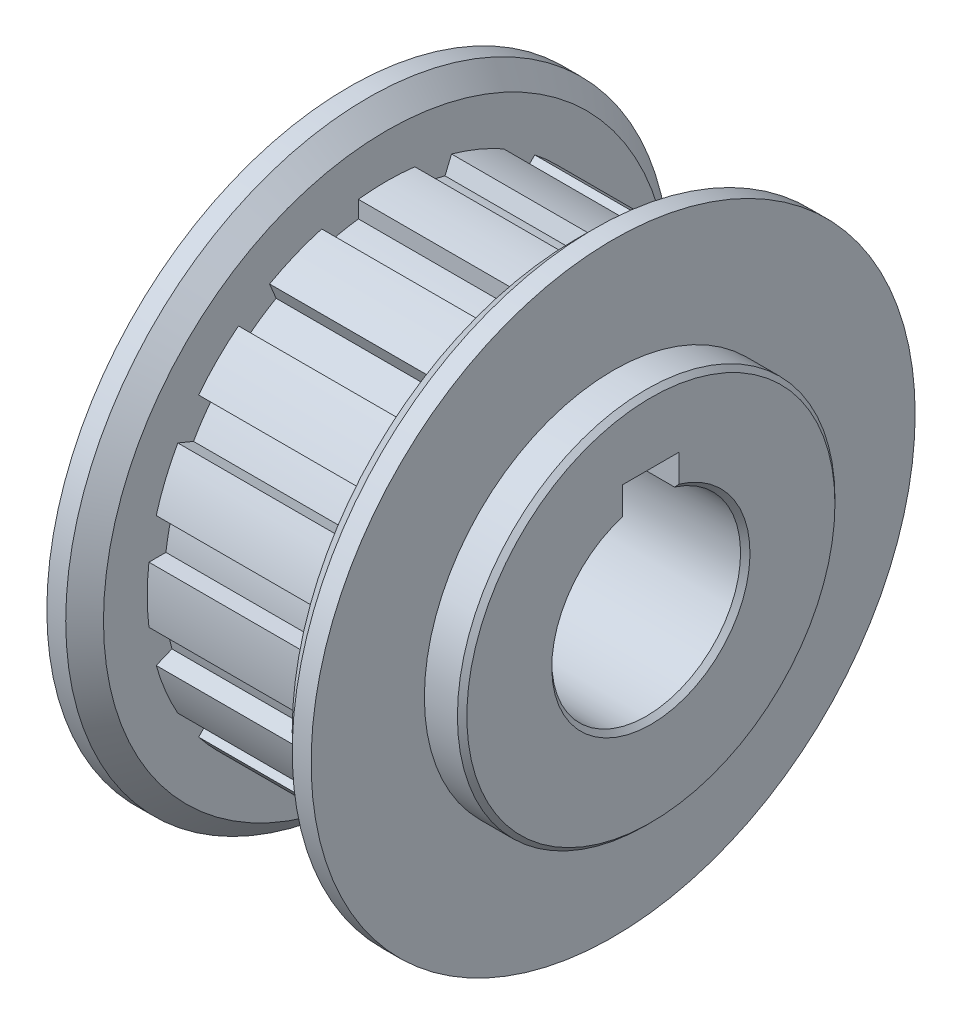
from build123d import *

# Parameters (mm, degrees)
BOSS_EXTRUDE1_START       = -13
BOSS_EXTRUDE1_DEPTH       = 14
BOSS_EXTRUDE1_START_2     = -25
BOSS_EXTRUDE1_2_OUTLINE_R = 9
BOSS_EXTRUDE1_2_DEPTH     = 12
BOSS_EXTRUDE1_START_3     = -1
BOSS_EXTRUDE1_3_OUTLINE_R = 16
BOSS_EXTRUDE1_3_DEPTH     = 2
BOSS_EXTRUDE1_4_OUTLINE_R = 14.25
BOSS_EXTRUDE1_4_DEPTH     = 0.9999999
SKETCH5_R                 = 16
BOSS_EXTRUDE3_DEPTH       = 2
SKETCH6_R                 = 10
BOSS_EXTRUDE4_DEPTH       = 12
CHAMFER1_SIZE             = 1
CUT_EXTRUDE1_START        = -10
SKETCH2_R                 = 10
SKETCH2_R_2               = 7.5
CUT_EXTRUDE1_DEPTH        = 10
CUT_EXTRUDE2_DEPTH        = 28.712812921
CUT_EXTRUDE2_DEPTH_BACK   = 28.712812921
SKETCH4_R                 = 5
CUT_EXTRUDE3_START        = -10
SKETCH7_R                 = 7.5
CUT_EXTRUDE3_DEPTH        = 10
CHAMFER2_SIZE             = 0.25
SKETCH8_W                 = 3
SKETCH8_H                 = 3
CUT_EXTRUDE4_DEPTH        = 28.712812921


with BuildPart() as part:
    # Boss-Extrude1: read off the stored shape, not the designer's step
    # Boss-Extrude1 outline → Boss-Extrude1 (new body)
    with BuildSketch(Plane.ZY.offset(BOSS_EXTRUDE1_START)):
        with BuildLine():
            ThreePointArc((-1.493827307, 11.692460658), (-2.299627171, 11.561006493), (-3.094394503, 11.374088047))
            Line((-3.094394503, 11.374088047), (-3.438518062, 12.20487581))
            ThreePointArc((-3.438518062, 12.20487581), (-4.852425922, 11.714792472), (-6.19875101, 11.061549888))
            Line((-6.19875101, 11.061549888), (-5.854627451, 10.230762125))
            ThreePointArc((-5.854627451, 10.230762125), (-6.548784122, 9.800948055), (-7.211522801, 9.324113638))
            Line((-7.211522801, 9.324113638), (-7.847380226, 9.959971063))
            ThreePointArc((-7.847380226, 9.959971063), (-8.966113985, 8.966113985), (-9.959971063, 7.847380226))
            Line((-9.959971063, 7.847380226), (-9.324113638, 7.211522801))
            ThreePointArc((-9.324113638, 7.211522801), (-9.800948055, 6.548784122), (-10.230762125, 5.854627451))
            Line((-10.230762125, 5.854627451), (-11.061549888, 6.19875101))
            ThreePointArc((-11.061549888, 6.19875101), (-11.714792472, 4.852425922), (-12.20487581, 3.438518062))
            Line((-12.20487581, 3.438518062), (-11.374088047, 3.094394503))
            ThreePointArc((-11.374088047, 3.094394503), (-11.561006493, 2.299627171), (-11.692460658, 1.493827307))
            Line((-11.692460658, 1.493827307), (-12.591698852, 1.493827307))
            ThreePointArc((-12.591698852, 1.493827307), (-12.68, 0), (-12.591698852, -1.493827307))
            Line((-12.591698852, -1.493827307), (-11.692460658, -1.493827307))
            ThreePointArc((-11.692460658, -1.493827307), (-11.561006493, -2.299627171), (-11.374088047, -3.094394503))
            Line((-11.374088047, -3.094394503), (-12.20487581, -3.438518062))
            ThreePointArc((-12.20487581, -3.438518062), (-11.714792472, -4.852425922), (-11.061549888, -6.19875101))
            Line((-11.061549888, -6.19875101), (-10.230762125, -5.854627451))
            ThreePointArc((-10.230762125, -5.854627451), (-9.800948055, -6.548784122), (-9.324113638, -7.211522801))
            Line((-9.324113638, -7.211522801), (-9.959971063, -7.847380226))
            ThreePointArc((-9.959971063, -7.847380226), (-8.966113985, -8.966113985), (-7.847380226, -9.959971063))
            Line((-7.847380226, -9.959971063), (-7.211522801, -9.324113638))
            ThreePointArc((-7.211522801, -9.324113638), (-6.548784122, -9.800948055), (-5.854627451, -10.230762125))
            Line((-5.854627451, -10.230762125), (-6.19875101, -11.061549888))
            ThreePointArc((-6.19875101, -11.061549888), (-4.852425922, -11.714792472), (-3.438518062, -12.20487581))
            Line((-3.438518062, -12.20487581), (-3.094394503, -11.374088047))
            ThreePointArc((-3.094394503, -11.374088047), (-2.299627171, -11.561006493), (-1.493827307, -11.692460658))
            Line((-1.493827307, -11.692460658), (-1.493827307, -12.591698852))
            ThreePointArc((-1.493827307, -12.591698852), (0, -12.68), (1.493827307, -12.591698852))
            Line((1.493827307, -12.591698852), (1.493827307, -11.692460658))
            ThreePointArc((1.493827307, -11.692460658), (2.299627171, -11.561006493), (3.094394503, -11.374088047))
            Line((3.094394503, -11.374088047), (3.438518062, -12.20487581))
            ThreePointArc((3.438518062, -12.20487581), (4.852425922, -11.714792472), (6.19875101, -11.061549888))
            Line((6.19875101, -11.061549888), (5.854627451, -10.230762125))
            ThreePointArc((5.854627451, -10.230762125), (6.548784122, -9.800948055), (7.211522801, -9.324113638))
            Line((7.211522801, -9.324113638), (7.847380226, -9.959971063))
            ThreePointArc((7.847380226, -9.959971063), (8.966113985, -8.966113985), (9.959971063, -7.847380226))
            Line((9.959971063, -7.847380226), (9.324113638, -7.211522801))
            ThreePointArc((9.324113638, -7.211522801), (9.800948055, -6.548784122), (10.230762125, -5.854627451))
            Line((10.230762125, -5.854627451), (11.061549888, -6.19875101))
            ThreePointArc((11.061549888, -6.19875101), (11.714792472, -4.852425922), (12.20487581, -3.438518062))
            Line((12.20487581, -3.438518062), (11.374088047, -3.094394503))
            ThreePointArc((11.374088047, -3.094394503), (11.561006493, -2.299627171), (11.692460658, -1.493827307))
            Line((11.692460658, -1.493827307), (12.591698852, -1.493827307))
            ThreePointArc((12.591698852, -1.493827307), (12.68, 0), (12.591698852, 1.493827307))
            Line((12.591698852, 1.493827307), (11.692460658, 1.493827307))
            ThreePointArc((11.692460658, 1.493827307), (11.561006493, 2.299627171), (11.374088047, 3.094394503))
            Line((11.374088047, 3.094394503), (12.20487581, 3.438518062))
            ThreePointArc((12.20487581, 3.438518062), (11.714792472, 4.852425922), (11.061549888, 6.19875101))
            Line((11.061549888, 6.19875101), (10.230762125, 5.854627451))
            ThreePointArc((10.230762125, 5.854627451), (9.800948055, 6.548784122), (9.324113638, 7.211522801))
            Line((9.324113638, 7.211522801), (9.959971063, 7.847380226))
            ThreePointArc((9.959971063, 7.847380226), (8.966113985, 8.966113985), (7.847380226, 9.959971063))
            Line((7.847380226, 9.959971063), (7.211522801, 9.324113638))
            ThreePointArc((7.211522801, 9.324113638), (6.548784122, 9.800948055), (5.854627451, 10.230762125))
            Line((5.854627451, 10.230762125), (6.19875101, 11.061549888))
            ThreePointArc((6.19875101, 11.061549888), (4.852425922, 11.714792472), (3.438518062, 12.20487581))
            Line((3.438518062, 12.20487581), (3.094394503, 11.374088047))
            ThreePointArc((3.094394503, 11.374088047), (2.299627171, 11.561006493), (1.493827307, 11.692460658))
            Line((1.493827307, 11.692460658), (1.493827307, 12.591698852))
            ThreePointArc((1.493827307, 12.591698852), (0, 12.68), (-1.493827307, 12.591698852))
            Line((-1.493827307, 12.591698852), (-1.493827307, 11.692460658))
        make_face()
    extrude(amount=BOSS_EXTRUDE1_DEPTH)

    # Boss-Extrude1 2 outline → Boss-Extrude1 2 (add)
    with BuildSketch(Plane.ZY.offset(BOSS_EXTRUDE1_START_2)):
        Circle(BOSS_EXTRUDE1_2_OUTLINE_R)
    extrude(amount=BOSS_EXTRUDE1_2_DEPTH)

    # Boss-Extrude1 3 outline → Boss-Extrude1 3 (add)
    with BuildSketch(Plane.ZY.offset(BOSS_EXTRUDE1_START_3)):
        Circle(BOSS_EXTRUDE1_3_OUTLINE_R)
        with BuildLine():
            Line((-3.438518062, 12.20487581), (-3.094394503, 11.374088047))
            ThreePointArc((-3.094394503, 11.374088047), (-2.299627171, 11.561006493), (-1.493827307, 11.692460658))
            Line((-1.493827307, 11.692460658), (-1.493827307, 12.591698852))
            ThreePointArc((-1.493827307, 12.591698852), (0, 12.68), (1.493827307, 12.591698852))
            Line((1.493827307, 12.591698852), (1.493827307, 11.692460658))
            ThreePointArc((1.493827307, 11.692460658), (2.299627171, 11.561006493), (3.094394503, 11.374088047))
            Line((3.094394503, 11.374088047), (3.438518062, 12.20487581))
            ThreePointArc((3.438518062, 12.20487581), (4.852425922, 11.714792472), (6.19875101, 11.061549888))
            Line((6.19875101, 11.061549888), (5.854627451, 10.230762125))
            ThreePointArc((5.854627451, 10.230762125), (6.548784122, 9.800948055), (7.211522801, 9.324113638))
            Line((7.211522801, 9.324113638), (7.847380226, 9.959971063))
            ThreePointArc((7.847380226, 9.959971063), (8.966113985, 8.966113985), (9.959971063, 7.847380226))
            Line((9.959971063, 7.847380226), (9.324113638, 7.211522801))
            ThreePointArc((9.324113638, 7.211522801), (9.800948055, 6.548784122), (10.230762125, 5.854627451))
            Line((10.230762125, 5.854627451), (11.061549888, 6.19875101))
            ThreePointArc((11.061549888, 6.19875101), (11.714792472, 4.852425922), (12.20487581, 3.438518062))
            Line((12.20487581, 3.438518062), (11.374088047, 3.094394503))
            ThreePointArc((11.374088047, 3.094394503), (11.561006493, 2.299627171), (11.692460658, 1.493827307))
            Line((11.692460658, 1.493827307), (12.591698852, 1.493827307))
            ThreePointArc((12.591698852, 1.493827307), (12.68, 0), (12.591698852, -1.493827307))
            Line((12.591698852, -1.493827307), (11.692460658, -1.493827307))
            ThreePointArc((11.692460658, -1.493827307), (11.561006493, -2.299627171), (11.374088047, -3.094394503))
            Line((11.374088047, -3.094394503), (12.20487581, -3.438518062))
            ThreePointArc((12.20487581, -3.438518062), (11.714792472, -4.852425922), (11.061549888, -6.19875101))
            Line((11.061549888, -6.19875101), (10.230762125, -5.854627451))
            ThreePointArc((10.230762125, -5.854627451), (9.800948055, -6.548784122), (9.324113638, -7.211522801))
            Line((9.324113638, -7.211522801), (9.959971063, -7.847380226))
            ThreePointArc((9.959971063, -7.847380226), (8.966113985, -8.966113985), (7.847380226, -9.959971063))
            Line((7.847380226, -9.959971063), (7.211522801, -9.324113638))
            ThreePointArc((7.211522801, -9.324113638), (6.548784122, -9.800948055), (5.854627451, -10.230762125))
            Line((5.854627451, -10.230762125), (6.19875101, -11.061549888))
            ThreePointArc((6.19875101, -11.061549888), (4.852425922, -11.714792472), (3.438518062, -12.20487581))
            Line((3.438518062, -12.20487581), (3.094394503, -11.374088047))
            ThreePointArc((3.094394503, -11.374088047), (2.299627171, -11.561006493), (1.493827307, -11.692460658))
            Line((1.493827307, -11.692460658), (1.493827307, -12.591698852))
            ThreePointArc((1.493827307, -12.591698852), (0, -12.68), (-1.493827307, -12.591698852))
            Line((-1.493827307, -12.591698852), (-1.493827307, -11.692460658))
            ThreePointArc((-1.493827307, -11.692460658), (-2.299627171, -11.561006493), (-3.094394503, -11.374088047))
            Line((-3.094394503, -11.374088047), (-3.438518062, -12.20487581))
            ThreePointArc((-3.438518062, -12.20487581), (-4.852425922, -11.714792472), (-6.19875101, -11.061549888))
            Line((-6.19875101, -11.061549888), (-5.854627451, -10.230762125))
            ThreePointArc((-5.854627451, -10.230762125), (-6.548784122, -9.800948055), (-7.211522801, -9.324113638))
            Line((-7.211522801, -9.324113638), (-7.847380226, -9.959971063))
            ThreePointArc((-7.847380226, -9.959971063), (-8.966113985, -8.966113985), (-9.959971063, -7.847380226))
            Line((-9.959971063, -7.847380226), (-9.324113638, -7.211522801))
            ThreePointArc((-9.324113638, -7.211522801), (-9.800948055, -6.548784122), (-10.230762125, -5.854627451))
            Line((-10.230762125, -5.854627451), (-11.061549888, -6.19875101))
            ThreePointArc((-11.061549888, -6.19875101), (-11.714792472, -4.852425922), (-12.20487581, -3.438518062))
            Line((-12.20487581, -3.438518062), (-11.374088047, -3.094394503))
            ThreePointArc((-11.374088047, -3.094394503), (-11.561006493, -2.299627171), (-11.692460658, -1.493827307))
            Line((-11.692460658, -1.493827307), (-12.591698852, -1.493827307))
            ThreePointArc((-12.591698852, -1.493827307), (-12.68, 0), (-12.591698852, 1.493827307))
            Line((-12.591698852, 1.493827307), (-11.692460658, 1.493827307))
            ThreePointArc((-11.692460658, 1.493827307), (-11.561006493, 2.299627171), (-11.374088047, 3.094394503))
            Line((-11.374088047, 3.094394503), (-12.20487581, 3.438518062))
            ThreePointArc((-12.20487581, 3.438518062), (-11.714792472, 4.852425922), (-11.061549888, 6.19875101))
            Line((-11.061549888, 6.19875101), (-10.230762125, 5.854627451))
            ThreePointArc((-10.230762125, 5.854627451), (-9.800948055, 6.548784122), (-9.324113638, 7.211522801))
            Line((-9.324113638, 7.211522801), (-9.959971063, 7.847380226))
            ThreePointArc((-9.959971063, 7.847380226), (-8.966113985, 8.966113985), (-7.847380226, 9.959971063))
            Line((-7.847380226, 9.959971063), (-7.211522801, 9.324113638))
            ThreePointArc((-7.211522801, 9.324113638), (-6.548784122, 9.800948055), (-5.854627451, 10.230762125))
            Line((-5.854627451, 10.230762125), (-6.19875101, 11.061549888))
            ThreePointArc((-6.19875101, 11.061549888), (-4.852425922, 11.714792472), (-3.438518062, 12.20487581))
        make_face(mode=Mode.SUBTRACT)
    extrude(amount=BOSS_EXTRUDE1_3_DEPTH)

    # Boss-Extrude1 4 outline → Boss-Extrude1 4 (add)
    with BuildSketch(Plane.ZY.offset(BOSS_EXTRUDE1_START)):
        Circle(BOSS_EXTRUDE1_4_OUTLINE_R)
        with BuildLine():
            Line((-3.438518062, 12.20487581), (-3.094394503, 11.374088047))
            ThreePointArc((-3.094394503, 11.374088047), (-2.299627171, 11.561006493), (-1.493827307, 11.692460658))
            Line((-1.493827307, 11.692460658), (-1.493827307, 12.591698852))
            ThreePointArc((-1.493827307, 12.591698852), (0, 12.68), (1.493827307, 12.591698852))
            Line((1.493827307, 12.591698852), (1.493827307, 11.692460658))
            ThreePointArc((1.493827307, 11.692460658), (2.299627171, 11.561006493), (3.094394503, 11.374088047))
            Line((3.094394503, 11.374088047), (3.438518062, 12.20487581))
            ThreePointArc((3.438518062, 12.20487581), (4.852425922, 11.714792472), (6.19875101, 11.061549888))
            Line((6.19875101, 11.061549888), (5.854627451, 10.230762125))
            ThreePointArc((5.854627451, 10.230762125), (6.548784122, 9.800948055), (7.211522801, 9.324113638))
            Line((7.211522801, 9.324113638), (7.847380226, 9.959971063))
            ThreePointArc((7.847380226, 9.959971063), (8.966113985, 8.966113985), (9.959971063, 7.847380226))
            Line((9.959971063, 7.847380226), (9.324113638, 7.211522801))
            ThreePointArc((9.324113638, 7.211522801), (9.800948055, 6.548784122), (10.230762125, 5.854627451))
            Line((10.230762125, 5.854627451), (11.061549888, 6.19875101))
            ThreePointArc((11.061549888, 6.19875101), (11.714792472, 4.852425922), (12.20487581, 3.438518062))
            Line((12.20487581, 3.438518062), (11.374088047, 3.094394503))
            ThreePointArc((11.374088047, 3.094394503), (11.561006493, 2.299627171), (11.692460658, 1.493827307))
            Line((11.692460658, 1.493827307), (12.591698852, 1.493827307))
            ThreePointArc((12.591698852, 1.493827307), (12.68, 0), (12.591698852, -1.493827307))
            Line((12.591698852, -1.493827307), (11.692460658, -1.493827307))
            ThreePointArc((11.692460658, -1.493827307), (11.561006493, -2.299627171), (11.374088047, -3.094394503))
            Line((11.374088047, -3.094394503), (12.20487581, -3.438518062))
            ThreePointArc((12.20487581, -3.438518062), (11.714792472, -4.852425922), (11.061549888, -6.19875101))
            Line((11.061549888, -6.19875101), (10.230762125, -5.854627451))
            ThreePointArc((10.230762125, -5.854627451), (9.800948055, -6.548784122), (9.324113638, -7.211522801))
            Line((9.324113638, -7.211522801), (9.959971063, -7.847380226))
            ThreePointArc((9.959971063, -7.847380226), (8.966113985, -8.966113985), (7.847380226, -9.959971063))
            Line((7.847380226, -9.959971063), (7.211522801, -9.324113638))
            ThreePointArc((7.211522801, -9.324113638), (6.548784122, -9.800948055), (5.854627451, -10.230762125))
            Line((5.854627451, -10.230762125), (6.19875101, -11.061549888))
            ThreePointArc((6.19875101, -11.061549888), (4.852425922, -11.714792472), (3.438518062, -12.20487581))
            Line((3.438518062, -12.20487581), (3.094394503, -11.374088047))
            ThreePointArc((3.094394503, -11.374088047), (2.299627171, -11.561006493), (1.493827307, -11.692460658))
            Line((1.493827307, -11.692460658), (1.493827307, -12.591698852))
            ThreePointArc((1.493827307, -12.591698852), (0, -12.68), (-1.493827307, -12.591698852))
            Line((-1.493827307, -12.591698852), (-1.493827307, -11.692460658))
            ThreePointArc((-1.493827307, -11.692460658), (-2.299627171, -11.561006493), (-3.094394503, -11.374088047))
            Line((-3.094394503, -11.374088047), (-3.438518062, -12.20487581))
            ThreePointArc((-3.438518062, -12.20487581), (-4.852425922, -11.714792472), (-6.19875101, -11.061549888))
            Line((-6.19875101, -11.061549888), (-5.854627451, -10.230762125))
            ThreePointArc((-5.854627451, -10.230762125), (-6.548784122, -9.800948055), (-7.211522801, -9.324113638))
            Line((-7.211522801, -9.324113638), (-7.847380226, -9.959971063))
            ThreePointArc((-7.847380226, -9.959971063), (-8.966113985, -8.966113985), (-9.959971063, -7.847380226))
            Line((-9.959971063, -7.847380226), (-9.324113638, -7.211522801))
            ThreePointArc((-9.324113638, -7.211522801), (-9.800948055, -6.548784122), (-10.230762125, -5.854627451))
            Line((-10.230762125, -5.854627451), (-11.061549888, -6.19875101))
            ThreePointArc((-11.061549888, -6.19875101), (-11.714792472, -4.852425922), (-12.20487581, -3.438518062))
            Line((-12.20487581, -3.438518062), (-11.374088047, -3.094394503))
            ThreePointArc((-11.374088047, -3.094394503), (-11.561006493, -2.299627171), (-11.692460658, -1.493827307))
            Line((-11.692460658, -1.493827307), (-12.591698852, -1.493827307))
            ThreePointArc((-12.591698852, -1.493827307), (-12.68, 0), (-12.591698852, 1.493827307))
            Line((-12.591698852, 1.493827307), (-11.692460658, 1.493827307))
            ThreePointArc((-11.692460658, 1.493827307), (-11.561006493, 2.299627171), (-11.374088047, 3.094394503))
            Line((-11.374088047, 3.094394503), (-12.20487581, 3.438518062))
            ThreePointArc((-12.20487581, 3.438518062), (-11.714792472, 4.852425922), (-11.061549888, 6.19875101))
            Line((-11.061549888, 6.19875101), (-10.230762125, 5.854627451))
            ThreePointArc((-10.230762125, 5.854627451), (-9.800948055, 6.548784122), (-9.324113638, 7.211522801))
            Line((-9.324113638, 7.211522801), (-9.959971063, 7.847380226))
            ThreePointArc((-9.959971063, 7.847380226), (-8.966113985, 8.966113985), (-7.847380226, 9.959971063))
            Line((-7.847380226, 9.959971063), (-7.211522801, 9.324113638))
            ThreePointArc((-7.211522801, 9.324113638), (-6.548784122, 9.800948055), (-5.854627451, 10.230762125))
            Line((-5.854627451, 10.230762125), (-6.19875101, 11.061549888))
            ThreePointArc((-6.19875101, 11.061549888), (-4.852425922, 11.714792472), (-3.438518062, 12.20487581))
        make_face(mode=Mode.SUBTRACT)
    extrude(amount=BOSS_EXTRUDE1_4_DEPTH)

    # Boss-Extrude1 5 outline → Boss-Extrude1 5 (revolve)
    with BuildSketch(Plane.YX):
        Polygon((11.7875, 12.0000001), (11.7875, 11), (13.25, 11), (14.25, 12), align=None)
    revolve(axis=Axis((0, 0, 0), (1, 0, 0)))

    # Sketch5 → Boss-Extrude3 (add)
    with BuildSketch(Plane(origin=(13, 0, 0), x_dir=(0, 0, -1), z_dir=(1, 0, 0))):
        with Locations(Location((0, 0, 0), (0, 0, 180))):
            Circle(SKETCH5_R)
    extrude(amount=-BOSS_EXTRUDE3_DEPTH)

    # Sketch6 → Boss-Extrude4 (add)
    with BuildSketch(Plane(origin=(13, 0, 0), x_dir=(0, 0, -1), z_dir=(1, 0, 0))):
        Circle(SKETCH6_R)
    extrude(amount=BOSS_EXTRUDE4_DEPTH)

    # Chamfer1
    chamfer1_edges = [part.edges().sort_by_distance(p)[0] for p in [
        (1, 0, -16),
        (11, 0, -16),
    ]]
    chamfer(chamfer1_edges, length=CHAMFER1_SIZE)

    # Sketch2 → Cut-Extrude1 (cut)
    with BuildSketch(Plane(origin=(25, 0, 0), x_dir=(0, 0, -1), z_dir=(1, 0, 0)).offset(CUT_EXTRUDE1_START)):
        Circle(SKETCH2_R)
        Circle(SKETCH2_R_2, mode=Mode.SUBTRACT)
    extrude(amount=CUT_EXTRUDE1_DEPTH, mode=Mode.SUBTRACT)

    # Sketch4 → Cut-Extrude2 (cut, two sides: drawn at the far end of the back side and taken through both)
    with BuildSketch(Plane(origin=(15, 0, 0), x_dir=(0, 0, -1), z_dir=(1, 0, 0)).offset(-CUT_EXTRUDE2_DEPTH_BACK)):
        Circle(SKETCH4_R)
    extrude(amount=CUT_EXTRUDE2_DEPTH + CUT_EXTRUDE2_DEPTH_BACK, mode=Mode.SUBTRACT)

    # Sketch7 → Cut-Extrude3 (cut)
    with BuildSketch(Plane(origin=(25, 0, 0), x_dir=(0, 0, -1), z_dir=(1, 0, 0)).offset(CUT_EXTRUDE3_START)):
        Circle(SKETCH7_R)
    extrude(amount=CUT_EXTRUDE3_DEPTH, mode=Mode.SUBTRACT)

    # Chamfer2
    chamfer2_edges = [part.edges().sort_by_distance(p)[0] for p in [
        (15, 0, 10),
        (-1, 0, 5),
        (15, 0, 5),
    ]]
    chamfer(chamfer2_edges, length=CHAMFER2_SIZE)

    # Sketch8 → Cut-Extrude4 (cut, through all)
    with BuildSketch(Plane(origin=(15, 0, 0), x_dir=(0, 0, -1), z_dir=(1, 0, 0))):
        with Locations((0, 5)):
            Rectangle(SKETCH8_W, SKETCH8_H)
    extrude(amount=-CUT_EXTRUDE4_DEPTH, mode=Mode.SUBTRACT)


solid = part.part
